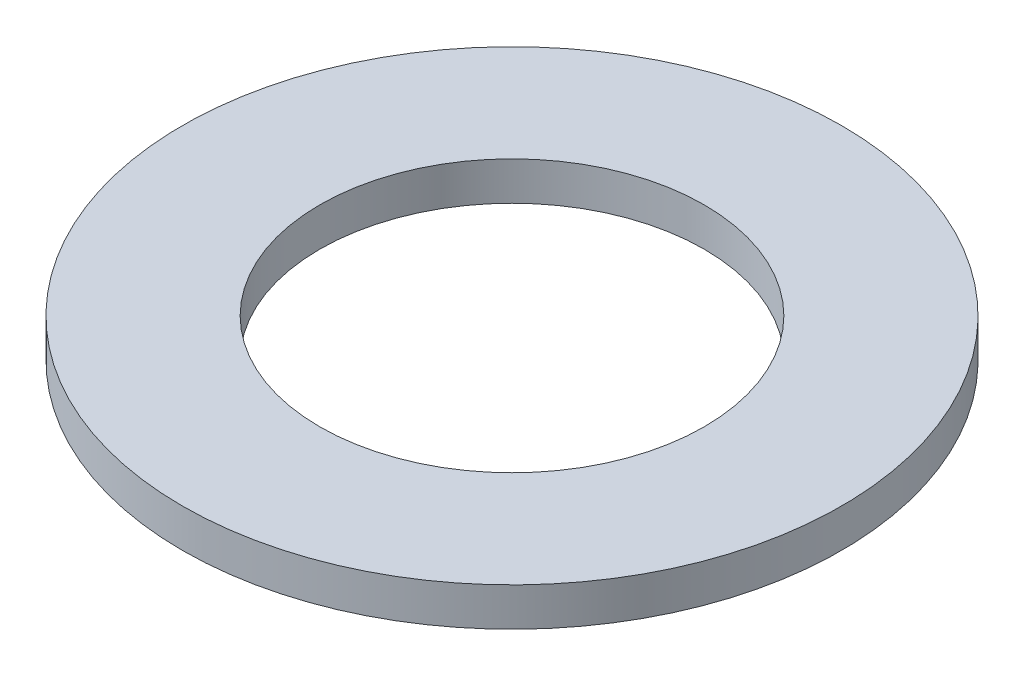
from build123d import *

# Parameters (mm, degrees)
SKETCH1_R           = 60
BOSS_EXTRUDE1_DEPTH = 7
SKETCH2_R           = 35
CUT_EXTRUDE1_DEPTH  = 86.141059425


with BuildPart() as part:
    # Sketch1 → Boss-Extrude1 (new body)
    with BuildSketch(Plane(origin=(0, 0, 0), x_dir=(1, 0, 0), z_dir=(0, 1, 0))):
        Circle(SKETCH1_R)
    extrude(amount=BOSS_EXTRUDE1_DEPTH)

    # Sketch2 → Cut-Extrude1 (cut, through all)
    with BuildSketch(Plane(origin=(0, 0, 0), x_dir=(1, 0, 0), z_dir=(0, 1, 0))):
        Circle(SKETCH2_R)
    extrude(amount=CUT_EXTRUDE1_DEPTH, mode=Mode.SUBTRACT)


solid = part.part
